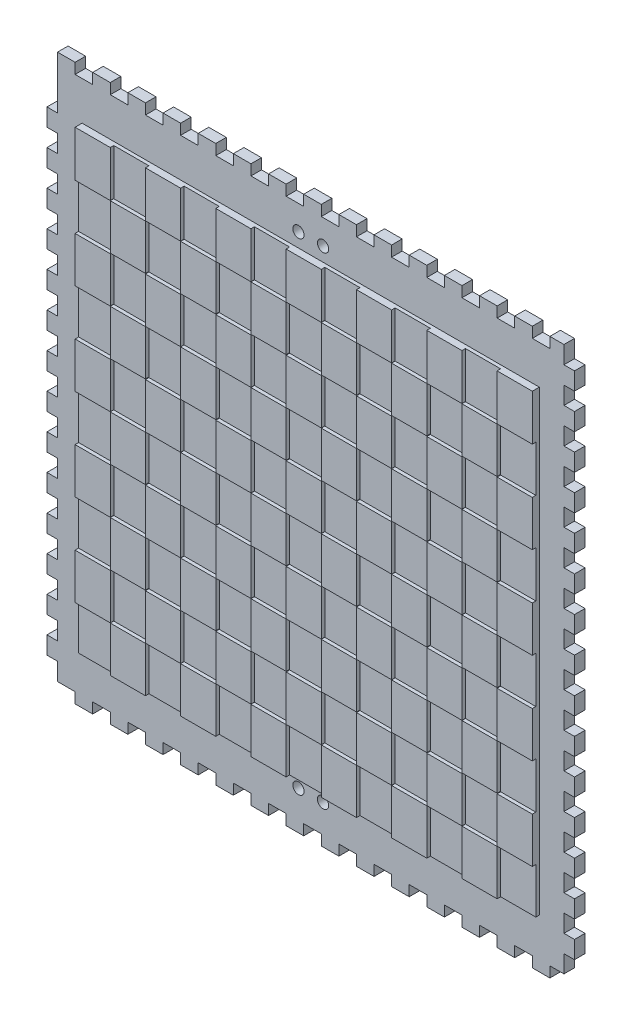
from build123d import *

# Parameters (mm, degrees)
SKETCH1_W            = 150
SKETCH1_H            = 158
BOSS_EXTRUDE1_DEPTH  = 5
SKETCH2_W            = 150
SKETCH2_H            = 158
SKETCH2_W_2          = 130
SKETCH2_H_2          = 130
CUT_EXTRUDE1_DEPTH   = 2
SKETCH3_W            = 10
SKETCH3_H            = 13.1
CUT_EXTRUDE2_DEPTH   = 1
LPATTERN1_COUNT      = 7
LPATTERN1_PITCH      = 20
LPATTERN1_COUNT_DIR2 = 5
LPATTERN1_PITCH_DIR2 = 26
SKETCH4_W            = 10
SKETCH4_H            = 13.1
CUT_EXTRUDE3_DEPTH   = 1
LPATTERN2_COUNT      = 6
LPATTERN2_PITCH      = 20
LPATTERN2_COUNT_DIR2 = 5
LPATTERN2_PITCH_DIR2 = 26
SKETCH5_W            = 3
SKETCH5_H            = 15
CUT_EXTRUDE4_DEPTH   = 10
SKETCH6_W            = 3
SKETCH6_H            = 5
CUT_EXTRUDE5_DEPTH   = 10
LPATTERN3_COUNT      = 14
LPATTERN3_PITCH      = 10
SKETCH7_W            = 3
SKETCH7_H            = 3
CUT_EXTRUDE6_DEPTH   = 10
SKETCH8_W            = 3
SKETCH8_H            = 8
CUT_EXTRUDE7_DEPTH   = 10
SKETCH9_W            = 3
SKETCH9_H            = 5
CUT_EXTRUDE8_DEPTH   = 10
LPATTERN4_COUNT      = 15
LPATTERN4_PITCH      = 10
SKETCH10_W           = 5
SKETCH10_H           = 3
CUT_EXTRUDE9_DEPTH   = 10
LPATTERN5_COUNT      = 14
LPATTERN5_PITCH      = 10
SKETCH11_W           = 5
SKETCH11_H           = 3
CUT_EXTRUDE10_DEPTH  = 3
LPATTERN6_COUNT      = 15
LPATTERN6_PITCH      = 10
SKETCH12_R           = 1.6
CUT_EXTRUDE11_DEPTH  = 15
SKETCH13_R           = 1.6
CUT_EXTRUDE12_DEPTH  = 10


with BuildPart() as part:
    # Sketch1 → Boss-Extrude1 (new body)
    with BuildSketch(Plane.XY):
        Rectangle(SKETCH1_W, SKETCH1_H)
    extrude(amount=BOSS_EXTRUDE1_DEPTH)

    # Sketch2 → Cut-Extrude1 (cut)
    with BuildSketch(Plane.XY.offset(5)):
        Rectangle(SKETCH2_W, SKETCH2_H)
        Rectangle(SKETCH2_W_2, SKETCH2_H_2, mode=Mode.SUBTRACT)
    extrude(amount=-CUT_EXTRUDE1_DEPTH, mode=Mode.SUBTRACT)

    # Sketch3 → Cut-Extrude2 (cut)
    with BuildSketch(Plane.XY.offset(5)):
        with Locations((-60, 45.4)):
            Rectangle(SKETCH3_W, SKETCH3_H)
    cut_extrude2 = extrude(amount=-CUT_EXTRUDE2_DEPTH, mode=Mode.SUBTRACT)

    # LPattern1: Cut-Extrude2 7 × 5
    with Locations(*[(i * LPATTERN1_PITCH, -j * LPATTERN1_PITCH_DIR2, 0) for i in range(LPATTERN1_COUNT) for j in range(LPATTERN1_COUNT_DIR2) if (i, j) != (0, 0)]):
        add(cut_extrude2, mode=Mode.SUBTRACT)

    # Sketch4 → Cut-Extrude3 (cut)
    with BuildSketch(Plane.XY.offset(5)):
        with Locations((-50, 58.45)):
            Rectangle(SKETCH4_W, SKETCH4_H)
    cut_extrude3 = extrude(amount=-CUT_EXTRUDE3_DEPTH, mode=Mode.SUBTRACT)

    # LPattern2: Cut-Extrude3 6 × 5
    with Locations(*[(i * LPATTERN2_PITCH, -j * LPATTERN2_PITCH_DIR2, 0) for i in range(LPATTERN2_COUNT) for j in range(LPATTERN2_COUNT_DIR2) if (i, j) != (0, 0)]):
        add(cut_extrude3, mode=Mode.SUBTRACT)

    # Sketch5 → Cut-Extrude4 (cut)
    with BuildSketch(Plane.XY.offset(3)):
        with Locations((-73.5, 71.5)):
            Rectangle(SKETCH5_W, SKETCH5_H)
    extrude(amount=-CUT_EXTRUDE4_DEPTH, mode=Mode.SUBTRACT)

    # Sketch6 → Cut-Extrude5 (cut)
    with BuildSketch(Plane.XY.offset(3)):
        with Locations((-73.5, 56.5)):
            Rectangle(SKETCH6_W, SKETCH6_H)
    cut_extrude5 = extrude(amount=-CUT_EXTRUDE5_DEPTH, mode=Mode.SUBTRACT)

    # LPattern3: Cut-Extrude5 ×14
    with Locations(*[(0, -i * LPATTERN3_PITCH, 0) for i in range(1, LPATTERN3_COUNT)]):
        add(cut_extrude5, mode=Mode.SUBTRACT)

    # Sketch7 → Cut-Extrude6 (cut)
    with BuildSketch(Plane.XY.offset(3)):
        with Locations((-73.5, -77.5)):
            Rectangle(SKETCH7_W, SKETCH7_H)
    extrude(amount=-CUT_EXTRUDE6_DEPTH, mode=Mode.SUBTRACT)

    # Sketch8 → Cut-Extrude7 (cut)
    with BuildSketch(Plane.XY.offset(3)):
        with Locations((73.5, -75)):
            Rectangle(SKETCH8_W, SKETCH8_H)
    extrude(amount=-CUT_EXTRUDE7_DEPTH, mode=Mode.SUBTRACT)

    # Sketch9 → Cut-Extrude8 (cut)
    with BuildSketch(Plane.XY.offset(3)):
        with Locations((73.5, -63.5)):
            Rectangle(SKETCH9_W, SKETCH9_H)
    cut_extrude8 = extrude(amount=-CUT_EXTRUDE8_DEPTH, mode=Mode.SUBTRACT)

    # LPattern4: Cut-Extrude8 ×15
    with Locations(*[(0, i * LPATTERN4_PITCH, 0) for i in range(1, LPATTERN4_COUNT)]):
        add(cut_extrude8, mode=Mode.SUBTRACT)

    # Sketch10 → Cut-Extrude9 (cut)
    with BuildSketch(Plane.XY.offset(3)):
        with Locations((-64.5, 77.5)):
            Rectangle(SKETCH10_W, SKETCH10_H)
    cut_extrude9 = extrude(amount=-CUT_EXTRUDE9_DEPTH, mode=Mode.SUBTRACT)

    # LPattern5: Cut-Extrude9 ×14
    with Locations(*[(i * LPATTERN5_PITCH, 0, 0) for i in range(1, LPATTERN5_COUNT)]):
        add(cut_extrude9, mode=Mode.SUBTRACT)

    # Sketch11 → Cut-Extrude10 (cut)
    with BuildSketch(Plane.XY.offset(3)):
        with Locations((-69.5, -77.5)):
            Rectangle(SKETCH11_W, SKETCH11_H)
    cut_extrude10 = extrude(amount=-CUT_EXTRUDE10_DEPTH, mode=Mode.SUBTRACT)

    # LPattern6: Cut-Extrude10 ×15
    with Locations(*[(i * LPATTERN6_PITCH, 0, 0) for i in range(1, LPATTERN6_COUNT)]):
        add(cut_extrude10, mode=Mode.SUBTRACT)

    # Sketch12 → Cut-Extrude11 (cut)
    with BuildSketch(Plane.XY.offset(3)):
        with Locations((3.5, 69)):
            Circle(SKETCH12_R)
        with Locations((-3.5, 69)):
            Circle(SKETCH12_R)
    extrude(amount=-CUT_EXTRUDE11_DEPTH, mode=Mode.SUBTRACT)

    # Sketch13 → Cut-Extrude12 (cut)
    with BuildSketch(Plane.XY.offset(3)):
        with Locations((3.5, -68)):
            Circle(SKETCH13_R)
        with Locations((-3.5, -68)):
            Circle(SKETCH13_R)
    extrude(amount=-CUT_EXTRUDE12_DEPTH, mode=Mode.SUBTRACT)


solid = part.part
